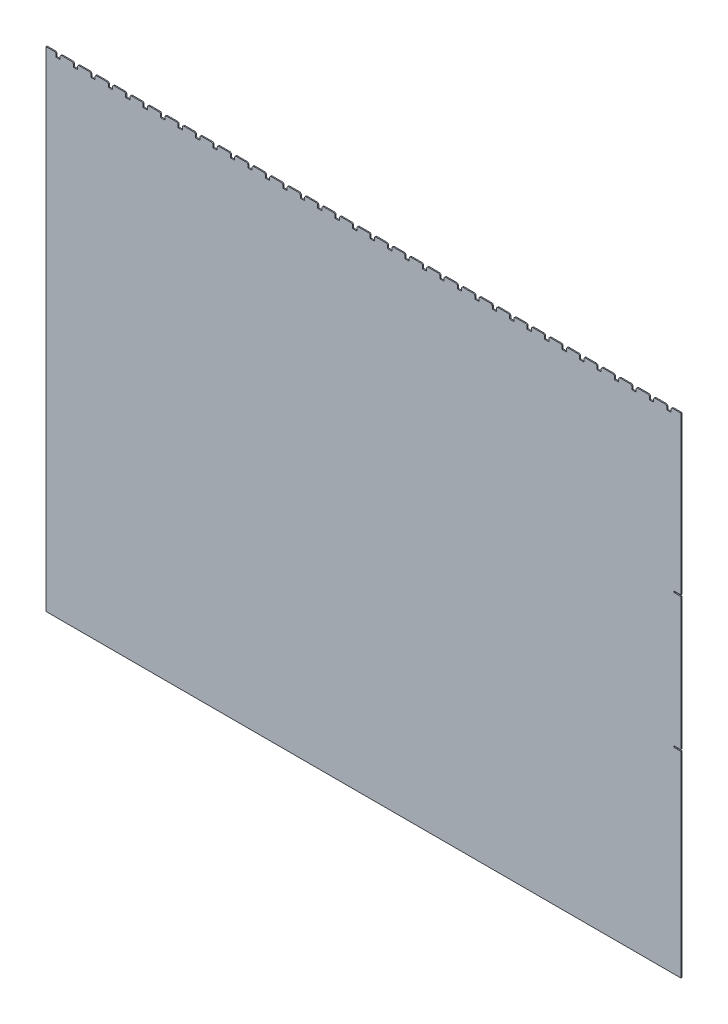
from build123d import *

# Parameters (mm, degrees)
SKETCH1_W          = 1200
SKETCH1_H          = 925
BASE_FLANGE1_DEPTH = 2
SKETCH3_W          = 8
SKETCH3_H          = 8
CUT_EXTRUDE1_DEPTH = 10
FILLET1_R          = 3
LPATTERN2_START    = -2
LPATTERN2_DEPTH    = 2
FILLET2_R          = 3
SKETCH4_W          = 2
SKETCH4_H          = 2.5
CUT_EXTRUDE2_DEPTH = 13
FILLET3_R          = 0.74


# Read off the part's stored shape, not the designer's step: LPattern2
# Sheet-metal steps are written as plain solids
with BuildPart() as part:
    # Sketch1 → Base-Flange1 (new body)
    with BuildSketch(Plane.XY):
        Rectangle(SKETCH1_W, SKETCH1_H)
    extrude(amount=-BASE_FLANGE1_DEPTH)

    # Sketch3 → Cut-Extrude1 (cut)
    with BuildSketch(Plane.XY):
        with Locations((-577.5, 458.5)):
            Rectangle(SKETCH3_W, SKETCH3_H)
        with Locations((412.5, 458.5)):
            Rectangle(SKETCH3_W, SKETCH3_H)
        with Locations((-544.5, 458.5)):
            Rectangle(SKETCH3_W, SKETCH3_H)
        with Locations((-511.5, 458.5)):
            Rectangle(SKETCH3_W, SKETCH3_H)
        with Locations((-478.5, 458.5)):
            Rectangle(SKETCH3_W, SKETCH3_H)
        with Locations((-445.5, 458.5)):
            Rectangle(SKETCH3_W, SKETCH3_H)
        with Locations((-412.5, 458.5)):
            Rectangle(SKETCH3_W, SKETCH3_H)
        with Locations((-379.5, 458.5)):
            Rectangle(SKETCH3_W, SKETCH3_H)
        with Locations((-346.5, 458.5)):
            Rectangle(SKETCH3_W, SKETCH3_H)
        with Locations((-313.5, 458.5)):
            Rectangle(SKETCH3_W, SKETCH3_H)
        with Locations((-280.5, 458.5)):
            Rectangle(SKETCH3_W, SKETCH3_H)
        with Locations((-247.5, 458.5)):
            Rectangle(SKETCH3_W, SKETCH3_H)
        with Locations((-214.5, 458.5)):
            Rectangle(SKETCH3_W, SKETCH3_H)
        with Locations((-181.5, 458.5)):
            Rectangle(SKETCH3_W, SKETCH3_H)
        with Locations((-148.5, 458.5)):
            Rectangle(SKETCH3_W, SKETCH3_H)
        with Locations((-115.5, 458.5)):
            Rectangle(SKETCH3_W, SKETCH3_H)
        with Locations((-82.5, 458.5)):
            Rectangle(SKETCH3_W, SKETCH3_H)
        with Locations((-49.5, 458.5)):
            Rectangle(SKETCH3_W, SKETCH3_H)
        with Locations((-16.5, 458.5)):
            Rectangle(SKETCH3_W, SKETCH3_H)
        with Locations((16.5, 458.5)):
            Rectangle(SKETCH3_W, SKETCH3_H)
        with Locations((49.5, 458.5)):
            Rectangle(SKETCH3_W, SKETCH3_H)
        with Locations((82.5, 458.5)):
            Rectangle(SKETCH3_W, SKETCH3_H)
        with Locations((115.5, 458.5)):
            Rectangle(SKETCH3_W, SKETCH3_H)
        with Locations((148.5, 458.5)):
            Rectangle(SKETCH3_W, SKETCH3_H)
        with Locations((181.5, 458.5)):
            Rectangle(SKETCH3_W, SKETCH3_H)
        with Locations((214.5, 458.5)):
            Rectangle(SKETCH3_W, SKETCH3_H)
        with Locations((247.5, 458.5)):
            Rectangle(SKETCH3_W, SKETCH3_H)
        with Locations((280.5, 458.5)):
            Rectangle(SKETCH3_W, SKETCH3_H)
        with Locations((313.5, 458.5)):
            Rectangle(SKETCH3_W, SKETCH3_H)
        with Locations((346.5, 458.5)):
            Rectangle(SKETCH3_W, SKETCH3_H)
        with Locations((379.5, 458.5)):
            Rectangle(SKETCH3_W, SKETCH3_H)
        with Locations((445.5, 458.5)):
            Rectangle(SKETCH3_W, SKETCH3_H)
        with Locations((478.5, 458.5)):
            Rectangle(SKETCH3_W, SKETCH3_H)
        with Locations((511.5, 458.5)):
            Rectangle(SKETCH3_W, SKETCH3_H)
        with Locations((544.5, 458.5)):
            Rectangle(SKETCH3_W, SKETCH3_H)
        with Locations((577.5, 458.5)):
            Rectangle(SKETCH3_W, SKETCH3_H)
    extrude(amount=-CUT_EXTRUDE1_DEPTH, mode=Mode.SUBTRACT)

    # Fillet1
    fillet1_edges = [part.edges().sort_by_distance(p)[0] for p in [
        (-573.5, 462.5, -1),
        (-548.5, 462.5, -1),
    ]]
    fillet(fillet1_edges, radius=FILLET1_R)

    # LPattern2 outline → LPattern2 (cut)
    with BuildSketch(Plane.XY.offset(LPATTERN2_START)):
        with BuildLine():
            Line((482.5, 462.5), (482.5, 459.5))
            ThreePointArc((482.5, 459.5), (483.378679656, 461.621320344), (485.5, 462.5))
            Line((485.5, 462.5), (482.5, 462.5))
        make_face()
        with BuildLine():
            Line((507.5, 462.5), (504.5, 462.5))
            ThreePointArc((504.5, 462.5), (506.621320344, 461.621320344), (507.5, 459.5))
            Line((507.5, 459.5), (507.5, 462.5))
        make_face()
        with BuildLine():
            Line((449.5, 462.5), (449.5, 459.5))
            ThreePointArc((449.5, 459.5), (450.378679656, 461.621320344), (452.5, 462.5))
            Line((452.5, 462.5), (449.5, 462.5))
        make_face()
        with BuildLine():
            Line((474.5, 462.5), (471.5, 462.5))
            ThreePointArc((471.5, 462.5), (473.621320344, 461.621320344), (474.5, 459.5))
            Line((474.5, 459.5), (474.5, 462.5))
        make_face()
        with BuildLine():
            Line((383.5, 462.5), (383.5, 459.5))
            ThreePointArc((383.5, 459.5), (384.378679656, 461.621320344), (386.5, 462.5))
            Line((386.5, 462.5), (383.5, 462.5))
        make_face()
        with BuildLine():
            Line((408.5, 462.5), (405.5, 462.5))
            ThreePointArc((405.5, 462.5), (407.621320344, 461.621320344), (408.5, 459.5))
            Line((408.5, 459.5), (408.5, 462.5))
        make_face()
        with BuildLine():
            Line((350.5, 462.5), (350.5, 459.5))
            ThreePointArc((350.5, 459.5), (351.378679656, 461.621320344), (353.5, 462.5))
            Line((353.5, 462.5), (350.5, 462.5))
        make_face()
        with BuildLine():
            Line((375.5, 462.5), (372.5, 462.5))
            ThreePointArc((372.5, 462.5), (374.621320344, 461.621320344), (375.5, 459.5))
            Line((375.5, 459.5), (375.5, 462.5))
        make_face()
        with BuildLine():
            Line((317.5, 462.5), (317.5, 459.5))
            ThreePointArc((317.5, 459.5), (318.378679656, 461.621320344), (320.5, 462.5))
            Line((320.5, 462.5), (317.5, 462.5))
        make_face()
        with BuildLine():
            Line((342.5, 462.5), (339.5, 462.5))
            ThreePointArc((339.5, 462.5), (341.621320344, 461.621320344), (342.5, 459.5))
            Line((342.5, 459.5), (342.5, 462.5))
        make_face()
        with BuildLine():
            Line((284.5, 462.5), (284.5, 459.5))
            ThreePointArc((284.5, 459.5), (285.378679656, 461.621320344), (287.5, 462.5))
            Line((287.5, 462.5), (284.5, 462.5))
        make_face()
        with BuildLine():
            Line((309.5, 462.5), (306.5, 462.5))
            ThreePointArc((306.5, 462.5), (308.621320344, 461.621320344), (309.5, 459.5))
            Line((309.5, 459.5), (309.5, 462.5))
        make_face()
        with BuildLine():
            Line((251.5, 462.5), (251.5, 459.5))
            ThreePointArc((251.5, 459.5), (252.378679656, 461.621320344), (254.5, 462.5))
            Line((254.5, 462.5), (251.5, 462.5))
        make_face()
        with BuildLine():
            Line((276.5, 462.5), (273.5, 462.5))
            ThreePointArc((273.5, 462.5), (275.621320344, 461.621320344), (276.5, 459.5))
            Line((276.5, 459.5), (276.5, 462.5))
        make_face()
        with BuildLine():
            Line((218.5, 462.5), (218.5, 459.5))
            ThreePointArc((218.5, 459.5), (219.378679656, 461.621320344), (221.5, 462.5))
            Line((221.5, 462.5), (218.5, 462.5))
        make_face()
        with BuildLine():
            Line((243.5, 462.5), (240.5, 462.5))
            ThreePointArc((240.5, 462.5), (242.621320344, 461.621320344), (243.5, 459.5))
            Line((243.5, 459.5), (243.5, 462.5))
        make_face()
        with BuildLine():
            Line((185.5, 462.5), (185.5, 459.5))
            ThreePointArc((185.5, 459.5), (186.378679656, 461.621320344), (188.5, 462.5))
            Line((188.5, 462.5), (185.5, 462.5))
        make_face()
        with BuildLine():
            Line((210.5, 462.5), (207.5, 462.5))
            ThreePointArc((207.5, 462.5), (209.621320344, 461.621320344), (210.5, 459.5))
            Line((210.5, 459.5), (210.5, 462.5))
        make_face()
        with BuildLine():
            Line((152.5, 462.5), (152.5, 459.5))
            ThreePointArc((152.5, 459.5), (153.378679656, 461.621320344), (155.5, 462.5))
            Line((155.5, 462.5), (152.5, 462.5))
        make_face()
        with BuildLine():
            Line((177.5, 462.5), (174.5, 462.5))
            ThreePointArc((174.5, 462.5), (176.621320344, 461.621320344), (177.5, 459.5))
            Line((177.5, 459.5), (177.5, 462.5))
        make_face()
        with BuildLine():
            Line((119.5, 462.5), (119.5, 459.5))
            ThreePointArc((119.5, 459.5), (120.378679656, 461.621320344), (122.5, 462.5))
            Line((122.5, 462.5), (119.5, 462.5))
        make_face()
        with BuildLine():
            Line((144.5, 462.5), (141.5, 462.5))
            ThreePointArc((141.5, 462.5), (143.621320344, 461.621320344), (144.5, 459.5))
            Line((144.5, 459.5), (144.5, 462.5))
        make_face()
        with BuildLine():
            Line((86.5, 462.5), (86.5, 459.5))
            ThreePointArc((86.5, 459.5), (87.378679656, 461.621320344), (89.5, 462.5))
            Line((89.5, 462.5), (86.5, 462.5))
        make_face()
        with BuildLine():
            Line((111.5, 462.5), (108.5, 462.5))
            ThreePointArc((108.5, 462.5), (110.621320344, 461.621320344), (111.5, 459.5))
            Line((111.5, 459.5), (111.5, 462.5))
        make_face()
        with BuildLine():
            Line((53.5, 462.5), (53.5, 459.5))
            ThreePointArc((53.5, 459.5), (54.378679656, 461.621320344), (56.5, 462.5))
            Line((56.5, 462.5), (53.5, 462.5))
        make_face()
        with BuildLine():
            Line((78.5, 462.5), (75.5, 462.5))
            ThreePointArc((75.5, 462.5), (77.621320344, 461.621320344), (78.5, 459.5))
            Line((78.5, 459.5), (78.5, 462.5))
        make_face()
        with BuildLine():
            Line((20.5, 462.5), (20.5, 459.5))
            ThreePointArc((20.5, 459.5), (21.378679656, 461.621320344), (23.5, 462.5))
            Line((23.5, 462.5), (20.5, 462.5))
        make_face()
        with BuildLine():
            Line((45.5, 462.5), (42.5, 462.5))
            ThreePointArc((42.5, 462.5), (44.621320344, 461.621320344), (45.5, 459.5))
            Line((45.5, 459.5), (45.5, 462.5))
        make_face()
        with BuildLine():
            Line((-12.5, 462.5), (-12.5, 459.5))
            ThreePointArc((-12.5, 459.5), (-11.621320344, 461.621320344), (-9.5, 462.5))
            Line((-9.5, 462.5), (-12.5, 462.5))
        make_face()
        with BuildLine():
            Line((12.5, 462.5), (9.5, 462.5))
            ThreePointArc((9.5, 462.5), (11.621320344, 461.621320344), (12.5, 459.5))
            Line((12.5, 459.5), (12.5, 462.5))
        make_face()
        with BuildLine():
            Line((-45.5, 462.5), (-45.5, 459.5))
            ThreePointArc((-45.5, 459.5), (-44.621320344, 461.621320344), (-42.5, 462.5))
            Line((-42.5, 462.5), (-45.5, 462.5))
        make_face()
        with BuildLine():
            Line((-20.5, 462.5), (-23.5, 462.5))
            ThreePointArc((-23.5, 462.5), (-21.378679656, 461.621320344), (-20.5, 459.5))
            Line((-20.5, 459.5), (-20.5, 462.5))
        make_face()
        with BuildLine():
            Line((-342.5, 462.5), (-342.5, 459.5))
            ThreePointArc((-342.5, 459.5), (-341.621320344, 461.621320344), (-339.5, 462.5))
            Line((-339.5, 462.5), (-342.5, 462.5))
        make_face()
        with BuildLine():
            Line((-317.5, 462.5), (-320.5, 462.5))
            ThreePointArc((-320.5, 462.5), (-318.378679656, 461.621320344), (-317.5, 459.5))
            Line((-317.5, 459.5), (-317.5, 462.5))
        make_face()
        with BuildLine():
            Line((-375.5, 462.5), (-375.5, 459.5))
            ThreePointArc((-375.5, 459.5), (-374.621320344, 461.621320344), (-372.5, 462.5))
            Line((-372.5, 462.5), (-375.5, 462.5))
        make_face()
        with BuildLine():
            Line((-350.5, 462.5), (-353.5, 462.5))
            ThreePointArc((-353.5, 462.5), (-351.378679656, 461.621320344), (-350.5, 459.5))
            Line((-350.5, 459.5), (-350.5, 462.5))
        make_face()
        with BuildLine():
            Line((-408.5, 462.5), (-408.5, 459.5))
            ThreePointArc((-408.5, 459.5), (-407.621320344, 461.621320344), (-405.5, 462.5))
            Line((-405.5, 462.5), (-408.5, 462.5))
        make_face()
        with BuildLine():
            Line((-383.5, 462.5), (-386.5, 462.5))
            ThreePointArc((-386.5, 462.5), (-384.378679656, 461.621320344), (-383.5, 459.5))
            Line((-383.5, 459.5), (-383.5, 462.5))
        make_face()
        with BuildLine():
            Line((-441.5, 462.5), (-441.5, 459.5))
            ThreePointArc((-441.5, 459.5), (-440.621320344, 461.621320344), (-438.5, 462.5))
            Line((-438.5, 462.5), (-441.5, 462.5))
        make_face()
        with BuildLine():
            Line((-416.5, 462.5), (-419.5, 462.5))
            ThreePointArc((-419.5, 462.5), (-417.378679656, 461.621320344), (-416.5, 459.5))
            Line((-416.5, 459.5), (-416.5, 462.5))
        make_face()
        with BuildLine():
            Line((416.5, 462.5), (416.5, 459.5))
            ThreePointArc((416.5, 459.5), (417.378679656, 461.621320344), (419.5, 462.5))
            Line((419.5, 462.5), (416.5, 462.5))
        make_face()
        with BuildLine():
            Line((441.5, 462.5), (438.5, 462.5))
            ThreePointArc((438.5, 462.5), (440.621320344, 461.621320344), (441.5, 459.5))
            Line((441.5, 459.5), (441.5, 462.5))
        make_face()
        with BuildLine():
            Line((-540.5, 462.5), (-540.5, 459.5))
            ThreePointArc((-540.5, 459.5), (-539.621320344, 461.621320344), (-537.5, 462.5))
            Line((-537.5, 462.5), (-540.5, 462.5))
        make_face()
        with BuildLine():
            Line((-515.5, 462.5), (-518.5, 462.5))
            ThreePointArc((-518.5, 462.5), (-516.378679656, 461.621320344), (-515.5, 459.5))
            Line((-515.5, 459.5), (-515.5, 462.5))
        make_face()
        with BuildLine():
            Line((-507.5, 462.5), (-507.5, 459.5))
            ThreePointArc((-507.5, 459.5), (-506.621320344, 461.621320344), (-504.5, 462.5))
            Line((-504.5, 462.5), (-507.5, 462.5))
        make_face()
        with BuildLine():
            Line((-482.5, 462.5), (-485.5, 462.5))
            ThreePointArc((-485.5, 462.5), (-483.378679656, 461.621320344), (-482.5, 459.5))
            Line((-482.5, 459.5), (-482.5, 462.5))
        make_face()
        with BuildLine():
            Line((-474.5, 462.5), (-474.5, 459.5))
            ThreePointArc((-474.5, 459.5), (-473.621320344, 461.621320344), (-471.5, 462.5))
            Line((-471.5, 462.5), (-474.5, 462.5))
        make_face()
        with BuildLine():
            Line((-449.5, 462.5), (-452.5, 462.5))
            ThreePointArc((-452.5, 462.5), (-450.378679656, 461.621320344), (-449.5, 459.5))
            Line((-449.5, 459.5), (-449.5, 462.5))
        make_face()
        with BuildLine():
            Line((-309.5, 462.5), (-309.5, 459.5))
            ThreePointArc((-309.5, 459.5), (-308.621320344, 461.621320344), (-306.5, 462.5))
            Line((-306.5, 462.5), (-309.5, 462.5))
        make_face()
        with BuildLine():
            Line((-284.5, 462.5), (-287.5, 462.5))
            ThreePointArc((-287.5, 462.5), (-285.378679656, 461.621320344), (-284.5, 459.5))
            Line((-284.5, 459.5), (-284.5, 462.5))
        make_face()
        with BuildLine():
            Line((-276.5, 462.5), (-276.5, 459.5))
            ThreePointArc((-276.5, 459.5), (-275.621320344, 461.621320344), (-273.5, 462.5))
            Line((-273.5, 462.5), (-276.5, 462.5))
        make_face()
        with BuildLine():
            Line((-251.5, 462.5), (-254.5, 462.5))
            ThreePointArc((-254.5, 462.5), (-252.378679656, 461.621320344), (-251.5, 459.5))
            Line((-251.5, 459.5), (-251.5, 462.5))
        make_face()
        with BuildLine():
            Line((-243.5, 462.5), (-243.5, 459.5))
            ThreePointArc((-243.5, 459.5), (-242.621320344, 461.621320344), (-240.5, 462.5))
            Line((-240.5, 462.5), (-243.5, 462.5))
        make_face()
        with BuildLine():
            Line((-218.5, 462.5), (-221.5, 462.5))
            ThreePointArc((-221.5, 462.5), (-219.378679656, 461.621320344), (-218.5, 459.5))
            Line((-218.5, 459.5), (-218.5, 462.5))
        make_face()
        with BuildLine():
            Line((-210.5, 462.5), (-210.5, 459.5))
            ThreePointArc((-210.5, 459.5), (-209.621320344, 461.621320344), (-207.5, 462.5))
            Line((-207.5, 462.5), (-210.5, 462.5))
        make_face()
        with BuildLine():
            Line((-185.5, 462.5), (-188.5, 462.5))
            ThreePointArc((-188.5, 462.5), (-186.378679656, 461.621320344), (-185.5, 459.5))
            Line((-185.5, 459.5), (-185.5, 462.5))
        make_face()
        with BuildLine():
            Line((-177.5, 462.5), (-177.5, 459.5))
            ThreePointArc((-177.5, 459.5), (-176.621320344, 461.621320344), (-174.5, 462.5))
            Line((-174.5, 462.5), (-177.5, 462.5))
        make_face()
        with BuildLine():
            Line((-152.5, 462.5), (-155.5, 462.5))
            ThreePointArc((-155.5, 462.5), (-153.378679656, 461.621320344), (-152.5, 459.5))
            Line((-152.5, 459.5), (-152.5, 462.5))
        make_face()
        with BuildLine():
            Line((-144.5, 462.5), (-144.5, 459.5))
            ThreePointArc((-144.5, 459.5), (-143.621320344, 461.621320344), (-141.5, 462.5))
            Line((-141.5, 462.5), (-144.5, 462.5))
        make_face()
        with BuildLine():
            Line((-119.5, 462.5), (-122.5, 462.5))
            ThreePointArc((-122.5, 462.5), (-120.378679656, 461.621320344), (-119.5, 459.5))
            Line((-119.5, 459.5), (-119.5, 462.5))
        make_face()
        with BuildLine():
            Line((-111.5, 462.5), (-111.5, 459.5))
            ThreePointArc((-111.5, 459.5), (-110.621320344, 461.621320344), (-108.5, 462.5))
            Line((-108.5, 462.5), (-111.5, 462.5))
        make_face()
        with BuildLine():
            Line((-86.5, 462.5), (-89.5, 462.5))
            ThreePointArc((-89.5, 462.5), (-87.378679656, 461.621320344), (-86.5, 459.5))
            Line((-86.5, 459.5), (-86.5, 462.5))
        make_face()
        with BuildLine():
            Line((-78.5, 462.5), (-78.5, 459.5))
            ThreePointArc((-78.5, 459.5), (-77.621320344, 461.621320344), (-75.5, 462.5))
            Line((-75.5, 462.5), (-78.5, 462.5))
        make_face()
        with BuildLine():
            Line((-53.5, 462.5), (-56.5, 462.5))
            ThreePointArc((-56.5, 462.5), (-54.378679656, 461.621320344), (-53.5, 459.5))
            Line((-53.5, 459.5), (-53.5, 462.5))
        make_face()
        with BuildLine():
            Line((515.5, 462.5), (515.5, 459.5))
            ThreePointArc((515.5, 459.5), (516.378679656, 461.621320344), (518.5, 462.5))
            Line((518.5, 462.5), (515.5, 462.5))
        make_face()
        with BuildLine():
            Line((540.5, 462.5), (537.5, 462.5))
            ThreePointArc((537.5, 462.5), (539.621320344, 461.621320344), (540.5, 459.5))
            Line((540.5, 459.5), (540.5, 462.5))
        make_face()
        with BuildLine():
            Line((548.5, 462.5), (548.5, 459.5))
            ThreePointArc((548.5, 459.5), (549.378679656, 461.621320344), (551.5, 462.5))
            Line((551.5, 462.5), (548.5, 462.5))
        make_face()
        with BuildLine():
            Line((573.5, 462.5), (570.5, 462.5))
            ThreePointArc((570.5, 462.5), (572.621320344, 461.621320344), (573.5, 459.5))
            Line((573.5, 459.5), (573.5, 462.5))
        make_face()
    extrude(amount=LPATTERN2_DEPTH, mode=Mode.SUBTRACT)

    # Fillet2
    fillet2_edges = [part.edges().sort_by_distance(p)[0] for p in [
        (-581.5, 462.5, -1),
        (581.5, 462.5, -1),
    ]]
    fillet(fillet2_edges, radius=FILLET2_R)

    # Sketch4 → Cut-Extrude2 (cut)
    with BuildSketch(Plane(origin=(600, 0, 0), x_dir=(0, 0, -1), z_dir=(1, 0, 0))):
        with Locations((1, 163.52509687)):
            Rectangle(SKETCH4_W, SKETCH4_H)
        with Locations((1, -90.004127425)):
            Rectangle(SKETCH4_W, SKETCH4_H)
    extrude(amount=-CUT_EXTRUDE2_DEPTH, mode=Mode.SUBTRACT)

    # Fillet3
    fillet3_edges = [part.edges().sort_by_distance(p)[0] for p in [
        (600, 162.27509687, -1),
        (600, -88.754127425, -1),
    ]]
    fillet(fillet3_edges, radius=FILLET3_R)


solid = part.part
